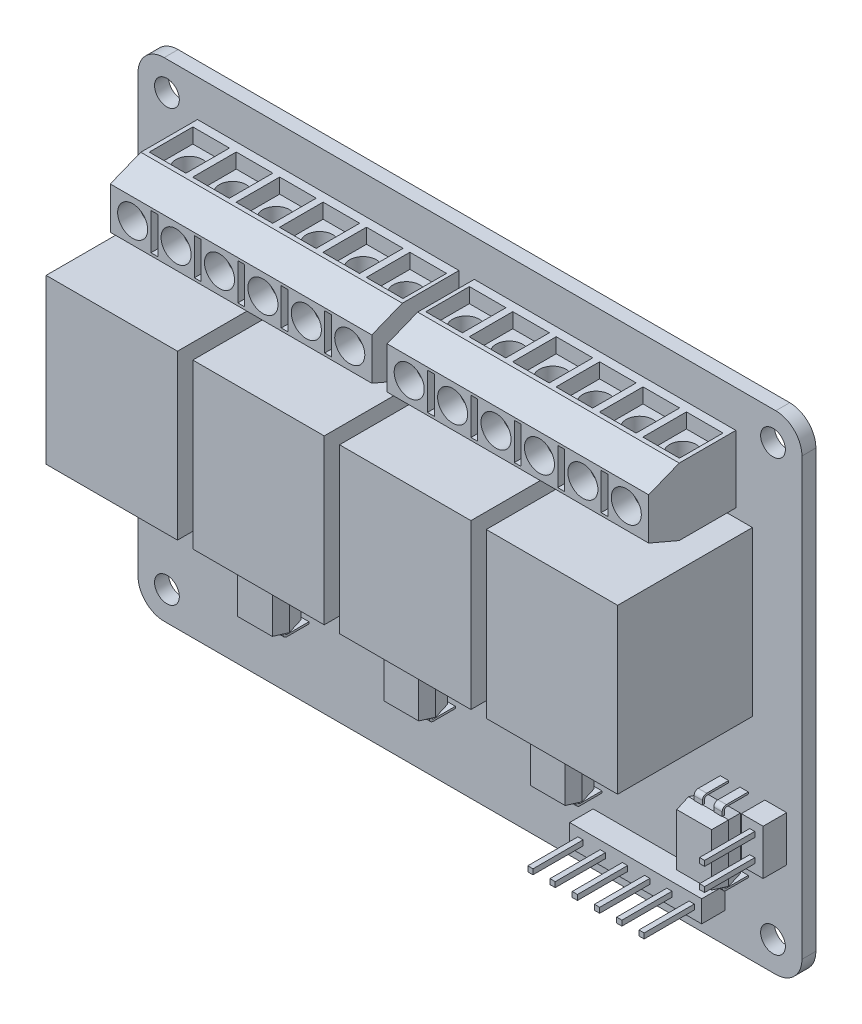
from build123d import *
from OCP.BRepFilletAPI import BRepFilletAPI_MakeChamfer

# Parameters (mm, degrees)
ESQUISSE1_R             = 1.42
BOSS_EXTRU_1_DEPTH      = 1.6
ESQUISSE2_W             = 15.07
ESQUISSE2_H             = 18.77
BOSS_EXTRU_2_DEPTH      = 15.46
ESQUISSE3_W             = 30
ESQUISSE3_H             = 7.7
BOSS_EXTRU_3_DEPTH      = 10
CHANFREIN1_SIZE         = 3.5
CHANFREIN1_SIZE2        = 1.4
CHANFREIN2_SIZE         = 3.5
CHANFREIN2_SIZE2        = 1.5
ESQUISSE4_W             = 4.2
ESQUISSE4_H             = 5
ENL_V_MAT_EXTRU_1_DEPTH = 1.7
ESQUISSE5_R             = 1.528276982
ENL_V_MAT_EXTRU_2_DEPTH = 5
ESQUISSE6_R             = 1.725
ESQUISSE6_W             = 0.78
ESQUISSE6_H             = 4.2
ENL_V_MAT_EXTRU_3_DEPTH = 2.38
ESQUISSE7_W             = 4.6
ESQUISSE7_H             = 6.6
BOSS_EXTRU_4_DEPTH      = 4.6
ESQUISSE8_W             = 1.3
ESQUISSE8_H             = 6.6
ENL_V_MAT_EXTRU_4_DEPTH = 85.157324102
CHANFREIN3_SIZE         = 1.65
CHANFREIN3_SIZE_2       = 0.3
CHANFREIN4_SIZE         = 1.65
CHANFREIN4_SIZE_2       = 0.3
CHANFREIN5_SIZE         = 1.65
CHANFREIN5_SIZE_2       = 0.3
CHANFREIN6_SIZE         = 1.65
CHANFREIN6_SIZE_2       = 0.3
ESQUISSE9_W             = 0.96
ESQUISSE9_H             = 0.96
BOSS_EXTRU_5_DEPTH      = 3
ENL_V_MAT_EXTRU_5_DEPTH = 84.662993611
ENL_V_MAT_EXTRU_6_DEPTH = 1.6
ESQUISSE12_W            = 2.5
ESQUISSE12_H            = 5.2
ESQUISSE12_W_2          = 15.15
ESQUISSE12_H_2          = 2.5
BOSS_EXTRU_6_DEPTH      = 2.7
ESQUISSE13_W            = 0.6
ESQUISSE13_H            = 0.6
ESQUISSE13_W_2          = 0.576923076
BOSS_EXTRU_7_DEPTH      = 5.75


with BuildPart() as part:
    # Esquisse1 → Boss.-Extru.1 (new body)
    with BuildSketch(Plane.XY):
        with BuildLine():
            Line((73.16, 56), (3, 56))
            ThreePointArc((3, 56), (0.878679656, 55.121320344), (0, 53))
            Line((0, 53), (0, 3))
            ThreePointArc((0, 3), (0.878679656, 0.878679656), (3, 0))
            Line((3, 0), (73.16, 0))
            ThreePointArc((73.16, 0), (75.281320344, 0.878679656), (76.16, 3))
            Line((76.16, 3), (76.16, 53))
            ThreePointArc((76.16, 53), (75.281320344, 55.121320344), (73.16, 56))
        make_face()
        with Locations((3.32, 52.68)):
            Circle(ESQUISSE1_R, mode=Mode.SUBTRACT)
        with Locations((3.32, 3.32)):
            Circle(ESQUISSE1_R, mode=Mode.SUBTRACT)
        with Locations((72.84, 3.32)):
            Circle(ESQUISSE1_R, mode=Mode.SUBTRACT)
        with Locations((72.84, 52.68)):
            Circle(ESQUISSE1_R, mode=Mode.SUBTRACT)
    extrude(amount=BOSS_EXTRU_1_DEPTH)

    # Esquisse2 → Boss.-Extru.2 (add)
    with BuildSketch(Plane.XY.offset(1.6)):
        with Locations((12.455, 33.675)):
            Rectangle(ESQUISSE2_W, ESQUISSE2_H)
        with Locations((29.285, 33.675)):
            Rectangle(ESQUISSE2_W, ESQUISSE2_H)
        with Locations((46.115, 33.675)):
            Rectangle(ESQUISSE2_W, ESQUISSE2_H)
        with Locations((62.945, 33.675)):
            Rectangle(ESQUISSE2_W, ESQUISSE2_H)
    extrude(amount=BOSS_EXTRU_2_DEPTH)

    # Esquisse3 → Boss.-Extru.3 (add)
    with BuildSketch(Plane.XY.offset(1.6)):
        with Locations((21.82, 47.91)):
            Rectangle(ESQUISSE3_W, ESQUISSE3_H)
        with Locations((53.58, 47.91)):
            Rectangle(ESQUISSE3_W, ESQUISSE3_H)
    extrude(amount=BOSS_EXTRU_3_DEPTH)

    # Chanfrein1: one chamfer whose edges measure the first distance from different faces: ONE call of the kernel's chamfer builder (chamfer() names one face for all edges)
    chanfrein1_edges_1 = [part.edges().sort_by_distance(p)[0] for p in [
        (53.58, 51.76, 11.6),
    ]]
    chanfrein1_side_1 = [part.faces().sort_by_distance(p)[0] for p in [
        (53.58, 51.76, 6.6),
    ]]
    chanfrein1_edges_2 = [part.edges().sort_by_distance(p)[0] for p in [
        (21.82, 51.76, 11.6),
    ]]
    chanfrein1_side_2 = [part.faces().sort_by_distance(p)[0] for p in [
        (21.82, 51.76, 6.6),
    ]]
    chanfrein1 = BRepFilletAPI_MakeChamfer(part.part.solid().wrapped)
    for e in chanfrein1_edges_1:
        chanfrein1.Add(CHANFREIN1_SIZE, CHANFREIN1_SIZE2, e.wrapped, chanfrein1_side_1[0].wrapped)  # the first distance lies on this face
    for e in chanfrein1_edges_2:
        chanfrein1.Add(CHANFREIN1_SIZE, CHANFREIN1_SIZE2, e.wrapped, chanfrein1_side_2[0].wrapped)  # the first distance lies on this face
    add(Compound.cast(chanfrein1.Shape()), mode=Mode.REPLACE)

    # Chanfrein2: one chamfer whose edges measure the first distance from different faces: ONE call of the kernel's chamfer builder (chamfer() names one face for all edges)
    chanfrein2_edges_1 = [part.edges().sort_by_distance(p)[0] for p in [
        (53.58, 44.06, 11.6),
    ]]
    chanfrein2_side_1 = [part.faces().sort_by_distance(p)[0] for p in [
        (53.58, 44.06, 6.6),
    ]]
    chanfrein2_edges_2 = [part.edges().sort_by_distance(p)[0] for p in [
        (21.82, 44.06, 11.6),
    ]]
    chanfrein2_side_2 = [part.faces().sort_by_distance(p)[0] for p in [
        (21.82, 44.06, 6.6),
    ]]
    chanfrein2 = BRepFilletAPI_MakeChamfer(part.part.solid().wrapped)
    for e in chanfrein2_edges_1:
        chanfrein2.Add(CHANFREIN2_SIZE, CHANFREIN2_SIZE2, e.wrapped, chanfrein2_side_1[0].wrapped)  # the first distance lies on this face
    for e in chanfrein2_edges_2:
        chanfrein2.Add(CHANFREIN2_SIZE, CHANFREIN2_SIZE2, e.wrapped, chanfrein2_side_2[0].wrapped)  # the first distance lies on this face
    add(Compound.cast(chanfrein2.Shape()), mode=Mode.REPLACE)

    # Esquisse4 → Enlèv. mat.-Extru.1 (cut)
    with BuildSketch(Plane(origin=(0, 51.76, 0), x_dir=(1, 0, 0), z_dir=(0, 1, 0))):
        with Locations((66.01, -5.1)):
            Rectangle(ESQUISSE4_W, ESQUISSE4_H)
        with Locations((61.03, -5.1)):
            Rectangle(ESQUISSE4_W, ESQUISSE4_H)
        with Locations((56.05, -5.1)):
            Rectangle(ESQUISSE4_W, ESQUISSE4_H)
        with Locations((51.07, -5.1)):
            Rectangle(ESQUISSE4_W, ESQUISSE4_H)
        with Locations((46.09, -5.1)):
            Rectangle(ESQUISSE4_W, ESQUISSE4_H)
        with Locations((41.11, -5.1)):
            Rectangle(ESQUISSE4_W, ESQUISSE4_H)
        with Locations((34.29, -5.1)):
            Rectangle(ESQUISSE4_W, ESQUISSE4_H)
        with Locations((29.31, -5.1)):
            Rectangle(ESQUISSE4_W, ESQUISSE4_H)
        with Locations((24.33, -5.1)):
            Rectangle(ESQUISSE4_W, ESQUISSE4_H)
        with Locations((19.35, -5.1)):
            Rectangle(ESQUISSE4_W, ESQUISSE4_H)
        with Locations((14.37, -5.1)):
            Rectangle(ESQUISSE4_W, ESQUISSE4_H)
        with Locations((9.39, -5.1)):
            Rectangle(ESQUISSE4_W, ESQUISSE4_H)
    extrude(amount=-ENL_V_MAT_EXTRU_1_DEPTH, mode=Mode.SUBTRACT)

    # Esquisse5 → Enlèv. mat.-Extru.2 (cut)
    with BuildSketch(Plane(origin=(0, 50.06, 0), x_dir=(1, 0, 0), z_dir=(0, 1, 0))):
        with Locations(Location((66.01, -5.1, 0), (0, 0, 270))):
            Circle(ESQUISSE5_R)
        with Locations(Location((61.03, -5.1, 0), (0, 0, 270))):
            Circle(ESQUISSE5_R)
        with Locations(Location((56.05, -5.1, 0), (0, 0, 270))):
            Circle(ESQUISSE5_R)
        with Locations(Location((51.07, -5.1, 0), (0, 0, 270))):
            Circle(ESQUISSE5_R)
        with Locations(Location((46.09, -5.1, 0), (0, 0, 270))):
            Circle(ESQUISSE5_R)
        with Locations(Location((41.11, -5.1, 0), (0, 0, 270))):
            Circle(ESQUISSE5_R)
        with Locations(Location((34.29, -5.1, 0), (0, 0, 90))):
            Circle(ESQUISSE5_R)
        with Locations(Location((29.31, -5.1, 0), (0, 0, 90))):
            Circle(ESQUISSE5_R)
        with Locations(Location((24.33, -5.1, 0), (0, 0, 90))):
            Circle(ESQUISSE5_R)
        with Locations(Location((19.35, -5.1, 0), (0, 0, 90))):
            Circle(ESQUISSE5_R)
        with Locations(Location((14.37, -5.1, 0), (0, 0, 90))):
            Circle(ESQUISSE5_R)
        with Locations(Location((9.39, -5.1, 0), (0, 0, 90))):
            Circle(ESQUISSE5_R)
    extrude(amount=-ENL_V_MAT_EXTRU_2_DEPTH, mode=Mode.SUBTRACT)

    # Esquisse6 → Enlèv. mat.-Extru.3 (cut)
    with BuildSketch(Plane.XY.offset(11.6)):
        with Locations((66.01, 47.96)):
            Circle(ESQUISSE6_R)
        with Locations((61.03, 47.96)):
            Circle(ESQUISSE6_R)
        with Locations((56.05, 47.96)):
            Circle(ESQUISSE6_R)
        with Locations((51.07, 47.96)):
            Circle(ESQUISSE6_R)
        with Locations((46.09, 47.96)):
            Circle(ESQUISSE6_R)
        with Locations((41.11, 47.96)):
            Circle(ESQUISSE6_R)
        with Locations(Location((34.29, 47.96, 0), (0, 0, 180))):
            Circle(ESQUISSE6_R)
        with Locations(Location((29.31, 47.96, 0), (0, 0, 180))):
            Circle(ESQUISSE6_R)
        with Locations(Location((24.33, 47.96, 0), (0, 0, 180))):
            Circle(ESQUISSE6_R)
        with Locations(Location((19.35, 47.96, 0), (0, 0, 180))):
            Circle(ESQUISSE6_R)
        with Locations(Location((14.37, 47.96, 0), (0, 0, 180))):
            Circle(ESQUISSE6_R)
        with Locations(Location((9.39, 47.96, 0), (0, 0, 180))):
            Circle(ESQUISSE6_R)
        with Locations((63.52, 47.96)):
            Rectangle(ESQUISSE6_W, ESQUISSE6_H)
        with Locations((58.54, 47.96)):
            Rectangle(ESQUISSE6_W, ESQUISSE6_H)
        with Locations((53.56, 47.96)):
            Rectangle(ESQUISSE6_W, ESQUISSE6_H)
        with Locations((48.58, 47.96)):
            Rectangle(ESQUISSE6_W, ESQUISSE6_H)
        with Locations((43.6, 47.96)):
            Rectangle(ESQUISSE6_W, ESQUISSE6_H)
        with Locations((31.8, 47.96)):
            Rectangle(ESQUISSE6_W, ESQUISSE6_H)
        with Locations((26.82, 47.96)):
            Rectangle(ESQUISSE6_W, ESQUISSE6_H)
        with Locations((21.84, 47.96)):
            Rectangle(ESQUISSE6_W, ESQUISSE6_H)
        with Locations((16.86, 47.96)):
            Rectangle(ESQUISSE6_W, ESQUISSE6_H)
        with Locations((11.88, 47.96)):
            Rectangle(ESQUISSE6_W, ESQUISSE6_H)
    extrude(amount=-ENL_V_MAT_EXTRU_3_DEPTH, mode=Mode.SUBTRACT)

    # Esquisse7 → Boss.-Extru.4 (add)
    with BuildSketch(Plane.XY.offset(1.6)):
        with Locations((18, 12.3)):
            Rectangle(ESQUISSE7_W, ESQUISSE7_H)
        with Locations((34.8, 12.3)):
            Rectangle(ESQUISSE7_W, ESQUISSE7_H)
        with Locations((51.6, 12.3)):
            Rectangle(ESQUISSE7_W, ESQUISSE7_H)
        with Locations((68.4, 12.3)):
            Rectangle(ESQUISSE7_W, ESQUISSE7_H)
    extrude(amount=BOSS_EXTRU_4_DEPTH)

    # Esquisse8 → Enlèv. mat.-Extru.4 (cut, through all)
    with BuildSketch(Plane.ZY.offset(-15.7)):
        with Locations((2.25, 12.3)):
            Rectangle(ESQUISSE8_W, ESQUISSE8_H)
    extrude(amount=-ENL_V_MAT_EXTRU_4_DEPTH, mode=Mode.SUBTRACT)


with BuildPart() as enl_v_mat_extru_4_piece_1:
    # of the separate pieces the step leaves, piece 1, a body of its own (enl_v_mat_extru_4_pieces)
    add(part.part.solids().sort_by_distance((6.82, 45.56, 11.6))[0])

    # Esquisse9 → Boss.-Extru.5 (add)
    with BuildSketch(Plane.XY.offset(1.6)):
        with Locations((16.87, 16.08)):
            Rectangle(ESQUISSE9_W, ESQUISSE9_H)
        with Locations((19.13, 16.08)):
            Rectangle(ESQUISSE9_W, ESQUISSE9_H)
        with Locations((16.87, 8.52)):
            Rectangle(ESQUISSE9_W, ESQUISSE9_H)
        with Locations((19.13, 8.52)):
            Rectangle(ESQUISSE9_W, ESQUISSE9_H)
        with Locations((33.67, 16.08)):
            Rectangle(ESQUISSE9_W, ESQUISSE9_H)
        with Locations((35.93, 16.08)):
            Rectangle(ESQUISSE9_W, ESQUISSE9_H)
        with Locations((33.67, 8.52)):
            Rectangle(ESQUISSE9_W, ESQUISSE9_H)
        with Locations((35.93, 8.52)):
            Rectangle(ESQUISSE9_W, ESQUISSE9_H)
        with Locations((50.47, 16.08)):
            Rectangle(ESQUISSE9_W, ESQUISSE9_H)
        with Locations((52.73, 16.08)):
            Rectangle(ESQUISSE9_W, ESQUISSE9_H)
        with Locations((50.47, 8.52)):
            Rectangle(ESQUISSE9_W, ESQUISSE9_H)
        with Locations((52.73, 8.52)):
            Rectangle(ESQUISSE9_W, ESQUISSE9_H)
        with Locations((67.27, 16.08)):
            Rectangle(ESQUISSE9_W, ESQUISSE9_H)
        with Locations((69.53, 16.08)):
            Rectangle(ESQUISSE9_W, ESQUISSE9_H)
        with Locations((67.27, 8.52)):
            Rectangle(ESQUISSE9_W, ESQUISSE9_H)
        with Locations((69.53, 8.52)):
            Rectangle(ESQUISSE9_W, ESQUISSE9_H)
    extrude(amount=BOSS_EXTRU_5_DEPTH)

    # Esquisse10 → Enlèv. mat.-Extru.5 (cut, through all)
    with BuildSketch(Plane.ZY.offset(-16.39)):
        with BuildLine():
            Line((4.346056616, 15.6), (4.346056616, 16.083830957))
            ThreePointArc((4.346056616, 16.083830957), (4.272833312, 16.260607653), (4.096056616, 16.333830957))
            Line((4.096056616, 16.333830957), (1.6, 16.333830957))
            Line((1.6, 16.333830957), (1.6, 15.6))
            Line((1.6, 15.6), (4.346056616, 15.6))
        make_face()
        with BuildLine():
            Line((4.12, 16.56), (4.6, 16.56))
            Line((4.6, 16.56), (4.6, 16.08))
            ThreePointArc((4.6, 16.08), (4.459411255, 16.419411255), (4.12, 16.56))
        make_face()
        with BuildLine():
            Line((4.6, 8.04), (4.6, 8.52))
            ThreePointArc((4.6, 8.52), (4.459411255, 8.180588745), (4.12, 8.04))
            Line((4.12, 8.04), (4.6, 8.04))
        make_face()
        with BuildLine():
            Line((1.6, 9), (4.346056616, 9))
            Line((4.346056616, 9), (4.346056616, 8.516169043))
            ThreePointArc((4.346056616, 8.516169043), (4.272833312, 8.339392347), (4.096056616, 8.266169043))
            Line((4.096056616, 8.266169043), (1.6, 8.266169043))
            Line((1.6, 8.266169043), (1.6, 9))
        make_face()
    extrude(amount=-ENL_V_MAT_EXTRU_5_DEPTH, mode=Mode.SUBTRACT)

    # Esquisse11 → Enlèv. mat.-Extru.6 (cut)
    with BuildSketch(Plane(origin=(0, 0, 0), x_dir=(-1, 0, 0), z_dir=(0, 0, -1))):
        Polygon((-66.32, 27.49), (-66.32, 24.075941441), (-64.395222683, 22.24), (-61.494777317, 22.24), (-59.57, 24.075941441), (-59.57, 27.49), (-60.57, 27.49), (-60.57, 24.504058559), (-61.895222683, 23.24), (-63.994777317, 23.24), (-65.32, 24.504058559), (-65.32, 27.49), align=None)
        Polygon((-49.49, 27.49), (-49.49, 24.075941441), (-47.565222683, 22.24), (-44.664777317, 22.24), (-42.74, 24.075941441), (-42.74, 27.49), (-43.74, 27.49), (-43.74, 24.504058559), (-45.065222683, 23.24), (-47.164777317, 23.24), (-48.49, 24.504058559), (-48.49, 27.49), align=None)
        Polygon((-32.66, 27.49), (-32.66, 24.075941441), (-30.735222683, 22.24), (-27.834777317, 22.24), (-25.91, 24.075941441), (-25.91, 27.49), (-26.91, 27.49), (-26.91, 24.504058559), (-28.235222683, 23.24), (-30.334777317, 23.24), (-31.66, 24.504058559), (-31.66, 27.49), align=None)
        Polygon((-15.83, 27.49), (-15.83, 24.075941441), (-13.905222683, 22.24), (-11.004777317, 22.24), (-9.08, 24.075941441), (-9.08, 27.49), (-10.08, 27.49), (-10.08, 24.504058559), (-11.405222683, 23.24), (-13.504777317, 23.24), (-14.83, 24.504058559), (-14.83, 27.49), align=None)
    extrude(amount=-ENL_V_MAT_EXTRU_6_DEPTH, mode=Mode.SUBTRACT)

    # Esquisse12 → Boss.-Extru.6 (add)
    with BuildSketch(Plane.XY.offset(1.6)):
        with Locations((73.16, 14.1)):
            Rectangle(ESQUISSE12_W, ESQUISSE12_H)
        with Locations((59.785, 4.72)):
            Rectangle(ESQUISSE12_W_2, ESQUISSE12_H_2)
    extrude(amount=BOSS_EXTRU_6_DEPTH)

    # Esquisse13 → Boss.-Extru.7 (add)
    with BuildSketch(Plane.XY.offset(4.3)):
        with Locations((56.01, 4.72)):
            Rectangle(ESQUISSE13_W, ESQUISSE13_H)
        with Locations((73.16, 15.4)):
            Rectangle(ESQUISSE13_W_2, ESQUISSE13_H)
        with Locations((73.16, 12.8)):
            Rectangle(ESQUISSE13_W_2, ESQUISSE13_H)
        with Locations((53.46, 4.72)):
            Rectangle(ESQUISSE13_W, ESQUISSE13_H)
        with Locations((58.56, 4.72)):
            Rectangle(ESQUISSE13_W, ESQUISSE13_H)
        with Locations((61.11, 4.72)):
            Rectangle(ESQUISSE13_W, ESQUISSE13_H)
        with Locations((63.66, 4.72)):
            Rectangle(ESQUISSE13_W, ESQUISSE13_H)
        with Locations((66.21, 4.72)):
            Rectangle(ESQUISSE13_W, ESQUISSE13_H)
    extrude(amount=BOSS_EXTRU_7_DEPTH)


with BuildPart() as enl_v_mat_extru_4_piece_2:
    # of the separate pieces the step leaves, piece 2, a body of its own (enl_v_mat_extru_4_pieces)
    add(part.part.solids().sort_by_distance((66.1, 15.6, 2.9))[0])

    # Chanfrein6
    # the kernel refuses this chamfer: 1.65, 0.3 mm, written as the material it takes off along each edge
    with BuildSketch(Plane(origin=(66.1, 19.887440135, 2.9), x_dir=(-0.0068843170681034405, 0, 0.9999763028084745), z_dir=(0, -1, 0)), Plane(origin=(66.1, 4.712559865, 6.2), x_dir=(-0.006884317068103437, 0, -0.9999763028084745), z_dir=(0, 1, 0)), Plane(origin=(70.7, 4.712559865, 2.9), x_dir=(0.0068843170681034405, 0, 0.9999763028084745), z_dir=(0, 1, 0))) as chanfrein6_piece_1:
        Polygon((CHANFREIN6_SIZE * 0.999976302808, -CHANFREIN6_SIZE * 0.0068843170681), (-CHANFREIN6_SIZE_2 * 0.0068843170681, -CHANFREIN6_SIZE_2 * 0.999976302808), (0, 0), align=None)
    extrude(amount=15.174880271, mode=Mode.SUBTRACT)
    with BuildSketch(Plane(origin=(61.812559865, 15.6, 2.9), x_dir=(0, 0.006884317068103438, 0.9999763028084744), z_dir=(1, 0, 0))) as chanfrein6_piece_2:
        Polygon((CHANFREIN6_SIZE * 0.999976302808, CHANFREIN6_SIZE * 0.0068843170681), (-CHANFREIN6_SIZE_2 * 0.0068843170681, CHANFREIN6_SIZE_2 * 0.999976302808), (0, 0), align=None)
    extrude(amount=13.174880271, mode=Mode.SUBTRACT)
    with BuildSketch(Plane(origin=(61.812559865, 15.6, 6.2), x_dir=(0, 0.006884317068103437, -0.9999763028084745), z_dir=(1, 0, 0)), Plane(origin=(61.812559865, 9, 2.9), x_dir=(0, -0.006884317068103438, 0.9999763028084744), z_dir=(1, 0, 0)), Plane(origin=(74.987440135, 9, 6.2), x_dir=(0, -0.006884317068103437, -0.9999763028084745), z_dir=(-1, 0, 0))) as chanfrein6_piece_3:
        Polygon((CHANFREIN6_SIZE * 0.999976302808, -CHANFREIN6_SIZE * 0.0068843170681), (-CHANFREIN6_SIZE_2 * 0.0068843170681, -CHANFREIN6_SIZE_2 * 0.999976302808), (0, 0), align=None)
    extrude(amount=13.174880271, mode=Mode.SUBTRACT)
    with BuildSketch(Plane(origin=(70.7, 19.887440135, 6.2), x_dir=(-0.9789956262001076, -2.1079340319315058e-15, 0.20388124945923566), z_dir=(0, -1, 0))) as chanfrein6_piece_4:
        Polygon((CHANFREIN6_SIZE_2 * 0.9789956262, CHANFREIN6_SIZE_2 * 0.203881249459), (-CHANFREIN6_SIZE * 0.203881249459, CHANFREIN6_SIZE * 0.9789956262), (0, 0), align=None)
    extrude(amount=15.174880271, mode=Mode.SUBTRACT)


with BuildPart() as enl_v_mat_extru_4_piece_3:
    # of the separate pieces the step leaves, piece 3, a body of its own (enl_v_mat_extru_4_pieces)
    add(part.part.solids().sort_by_distance((32.5, 15.6, 2.9))[0])

    # Chanfrein4
    # the kernel refuses this chamfer: 1.65, 0.3 mm, written as the material it takes off along each edge
    with BuildSketch(Plane(origin=(37.1, 4.712559865, 2.9), x_dir=(0.0068843170681034405, 0, 0.9999763028084745), z_dir=(0, 1, 0)), Plane(origin=(32.5, 19.887440135, 2.9), x_dir=(-0.0068843170681034405, 0, 0.9999763028084745), z_dir=(0, -1, 0)), Plane(origin=(32.5, 4.712559865, 6.2), x_dir=(-0.006884317068103437, 0, -0.9999763028084745), z_dir=(0, 1, 0))) as chanfrein4_piece_1:
        Polygon((CHANFREIN4_SIZE * 0.999976302808, -CHANFREIN4_SIZE * 0.0068843170681), (-CHANFREIN4_SIZE_2 * 0.0068843170681, -CHANFREIN4_SIZE_2 * 0.999976302808), (0, 0), align=None)
    extrude(amount=15.174880271, mode=Mode.SUBTRACT)
    with BuildSketch(Plane(origin=(37.1, 19.887440135, 6.2), x_dir=(-0.9789956262001076, 0, 0.20388124945923566), z_dir=(0, -1, 0))) as chanfrein4_piece_2:
        Polygon((CHANFREIN4_SIZE_2 * 0.9789956262, CHANFREIN4_SIZE_2 * 0.203881249459), (-CHANFREIN4_SIZE * 0.203881249459, CHANFREIN4_SIZE * 0.9789956262), (0, 0), align=None)
    extrude(amount=15.174880271, mode=Mode.SUBTRACT)
    with BuildSketch(Plane(origin=(28.212559865, 15.6, 2.9), x_dir=(0, 0.006884317068103438, 0.9999763028084744), z_dir=(1, 0, 0))) as chanfrein4_piece_3:
        Polygon((CHANFREIN4_SIZE * 0.999976302808, CHANFREIN4_SIZE * 0.0068843170681), (-CHANFREIN4_SIZE_2 * 0.0068843170681, CHANFREIN4_SIZE_2 * 0.999976302808), (0, 0), align=None)
    extrude(amount=13.174880271, mode=Mode.SUBTRACT)
    with BuildSketch(Plane(origin=(28.212559865, 15.6, 6.2), x_dir=(0, 0.006884317068103437, -0.9999763028084745), z_dir=(1, 0, 0)), Plane(origin=(28.212559865, 9, 2.9), x_dir=(0, -0.006884317068103438, 0.9999763028084744), z_dir=(1, 0, 0)), Plane(origin=(41.387440135, 9, 6.2), x_dir=(0, -0.006884317068103437, -0.9999763028084745), z_dir=(-1, 0, 0))) as chanfrein4_piece_4:
        Polygon((CHANFREIN4_SIZE * 0.999976302808, -CHANFREIN4_SIZE * 0.0068843170681), (-CHANFREIN4_SIZE_2 * 0.0068843170681, -CHANFREIN4_SIZE_2 * 0.999976302808), (0, 0), align=None)
    extrude(amount=13.174880271, mode=Mode.SUBTRACT)


with BuildPart() as enl_v_mat_extru_4_piece_4:
    # of the separate pieces the step leaves, piece 4, a body of its own (enl_v_mat_extru_4_pieces)
    add(part.part.solids().sort_by_distance((15.7, 15.6, 2.9))[0])

    # Chanfrein3
    # the kernel refuses this chamfer: 1.65, 0.3 mm, written as the material it takes off along each edge
    with BuildSketch(Plane(origin=(11.412559865, 15.6, 2.9), x_dir=(0, 0.006884317068103438, 0.9999763028084744), z_dir=(1, 0, 0))) as chanfrein3_piece_1:
        Polygon((CHANFREIN3_SIZE * 0.999976302808, CHANFREIN3_SIZE * 0.0068843170681), (-CHANFREIN3_SIZE_2 * 0.0068843170681, CHANFREIN3_SIZE_2 * 0.999976302808), (0, 0), align=None)
    extrude(amount=13.174880271, mode=Mode.SUBTRACT)
    with BuildSketch(Plane(origin=(11.412559865, 15.6, 6.2), x_dir=(0, 0.006884317068103437, -0.9999763028084745), z_dir=(1, 0, 0)), Plane(origin=(11.412559865, 9, 2.9), x_dir=(0, -0.006884317068103438, 0.9999763028084744), z_dir=(1, 0, 0)), Plane(origin=(24.587440135, 9, 6.2), x_dir=(0, -0.006884317068103437, -0.9999763028084745), z_dir=(-1, 0, 0))) as chanfrein3_piece_2:
        Polygon((CHANFREIN3_SIZE * 0.999976302808, -CHANFREIN3_SIZE * 0.0068843170681), (-CHANFREIN3_SIZE_2 * 0.0068843170681, -CHANFREIN3_SIZE_2 * 0.999976302808), (0, 0), align=None)
    extrude(amount=13.174880271, mode=Mode.SUBTRACT)
    with BuildSketch(Plane(origin=(20.3, 4.712559865, 2.9), x_dir=(0.0068843170681034405, 0, 0.9999763028084745), z_dir=(0, 1, 0)), Plane(origin=(15.7, 19.887440135, 2.9), x_dir=(-0.0068843170681034405, 0, 0.9999763028084745), z_dir=(0, -1, 0)), Plane(origin=(15.7, 4.712559865, 6.2), x_dir=(-0.006884317068103437, 0, -0.9999763028084745), z_dir=(0, 1, 0))) as chanfrein3_piece_3:
        Polygon((CHANFREIN3_SIZE * 0.999976302808, -CHANFREIN3_SIZE * 0.0068843170681), (-CHANFREIN3_SIZE_2 * 0.0068843170681, -CHANFREIN3_SIZE_2 * 0.999976302808), (0, 0), align=None)
    extrude(amount=15.174880271, mode=Mode.SUBTRACT)
    with BuildSketch(Plane(origin=(20.3, 19.887440135, 6.2), x_dir=(-0.978995626200108, 0, 0.20388124945923342), z_dir=(0, -1, 0))) as chanfrein3_piece_4:
        Polygon((CHANFREIN3_SIZE_2 * 0.9789956262, CHANFREIN3_SIZE_2 * 0.203881249459), (-CHANFREIN3_SIZE * 0.203881249459, CHANFREIN3_SIZE * 0.9789956262), (0, 0), align=None)
    extrude(amount=15.174880271, mode=Mode.SUBTRACT)


with BuildPart() as enl_v_mat_extru_4_piece_5:
    # of the separate pieces the step leaves, piece 5, a body of its own (enl_v_mat_extru_4_pieces)
    add(part.part.solids().sort_by_distance((49.3, 15.6, 2.9))[0])

    # Chanfrein5
    # the kernel refuses this chamfer: 1.65, 0.3 mm, written as the material it takes off along each edge
    with BuildSketch(Plane(origin=(45.012559865, 9, 2.9), x_dir=(0, -0.006884317068103438, 0.9999763028084744), z_dir=(1, 0, 0)), Plane(origin=(58.187440135, 9, 6.2), x_dir=(0, -0.006884317068103437, -0.9999763028084745), z_dir=(-1, 0, 0)), Plane(origin=(45.012559865, 15.6, 6.2), x_dir=(0, 0.006884317068103437, -0.9999763028084745), z_dir=(1, 0, 0))) as chanfrein5_piece_1:
        Polygon((CHANFREIN5_SIZE * 0.999976302808, -CHANFREIN5_SIZE * 0.0068843170681), (-CHANFREIN5_SIZE_2 * 0.0068843170681, -CHANFREIN5_SIZE_2 * 0.999976302808), (0, 0), align=None)
    extrude(amount=13.174880271, mode=Mode.SUBTRACT)
    with BuildSketch(Plane(origin=(49.3, 19.887440135, 2.9), x_dir=(-0.0068843170681034405, 0, 0.9999763028084745), z_dir=(0, -1, 0)), Plane(origin=(49.3, 4.712559865, 6.2), x_dir=(-0.006884317068103437, 0, -0.9999763028084745), z_dir=(0, 1, 0)), Plane(origin=(53.9, 4.712559865, 2.9), x_dir=(0.0068843170681034405, 0, 0.9999763028084745), z_dir=(0, 1, 0))) as chanfrein5_piece_2:
        Polygon((CHANFREIN5_SIZE * 0.999976302808, -CHANFREIN5_SIZE * 0.0068843170681), (-CHANFREIN5_SIZE_2 * 0.0068843170681, -CHANFREIN5_SIZE_2 * 0.999976302808), (0, 0), align=None)
    extrude(amount=15.174880271, mode=Mode.SUBTRACT)
    with BuildSketch(Plane(origin=(45.012559865, 15.6, 2.9), x_dir=(0, 0.006884317068103438, 0.9999763028084744), z_dir=(1, 0, 0))) as chanfrein5_piece_3:
        Polygon((CHANFREIN5_SIZE * 0.999976302808, CHANFREIN5_SIZE * 0.0068843170681), (-CHANFREIN5_SIZE_2 * 0.0068843170681, CHANFREIN5_SIZE_2 * 0.999976302808), (0, 0), align=None)
    extrude(amount=13.174880271, mode=Mode.SUBTRACT)
    with BuildSketch(Plane(origin=(53.9, 19.887440135, 6.2), x_dir=(-0.9789956262001076, 0, 0.20388124945923566), z_dir=(0, -1, 0))) as chanfrein5_piece_4:
        Polygon((CHANFREIN5_SIZE_2 * 0.9789956262, CHANFREIN5_SIZE_2 * 0.203881249459), (-CHANFREIN5_SIZE * 0.203881249459, CHANFREIN5_SIZE * 0.9789956262), (0, 0), align=None)
    extrude(amount=15.174880271, mode=Mode.SUBTRACT)


solid = Compound([enl_v_mat_extru_4_piece_1.part, enl_v_mat_extru_4_piece_2.part, enl_v_mat_extru_4_piece_3.part, enl_v_mat_extru_4_piece_4.part, enl_v_mat_extru_4_piece_5.part])
